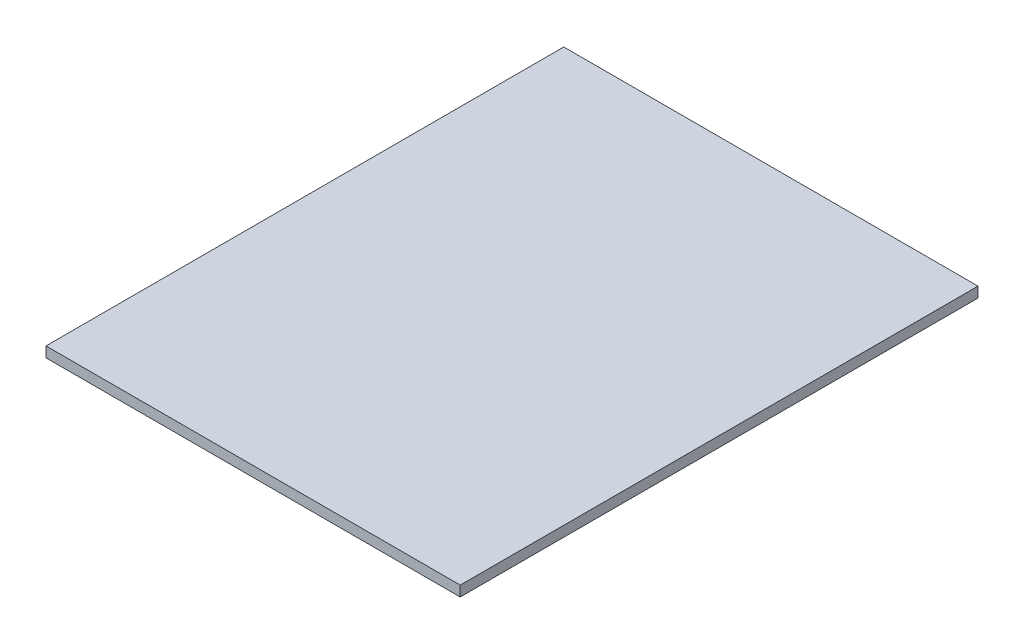
from build123d import *

# Parameters (mm, degrees)
SKETCH1_W           = 200
SKETCH1_H           = 250
BOSS_EXTRUDE1_DEPTH = 5


with BuildPart() as part:
    # Sketch1 → Boss-Extrude1 (new body)
    with BuildSketch(Plane(origin=(0, 0, 0), x_dir=(1, 0, 0), z_dir=(0, 1, 0))):
        with Locations((100, 125)):
            Rectangle(SKETCH1_W, SKETCH1_H)
    extrude(amount=BOSS_EXTRUDE1_DEPTH)


solid = part.part
